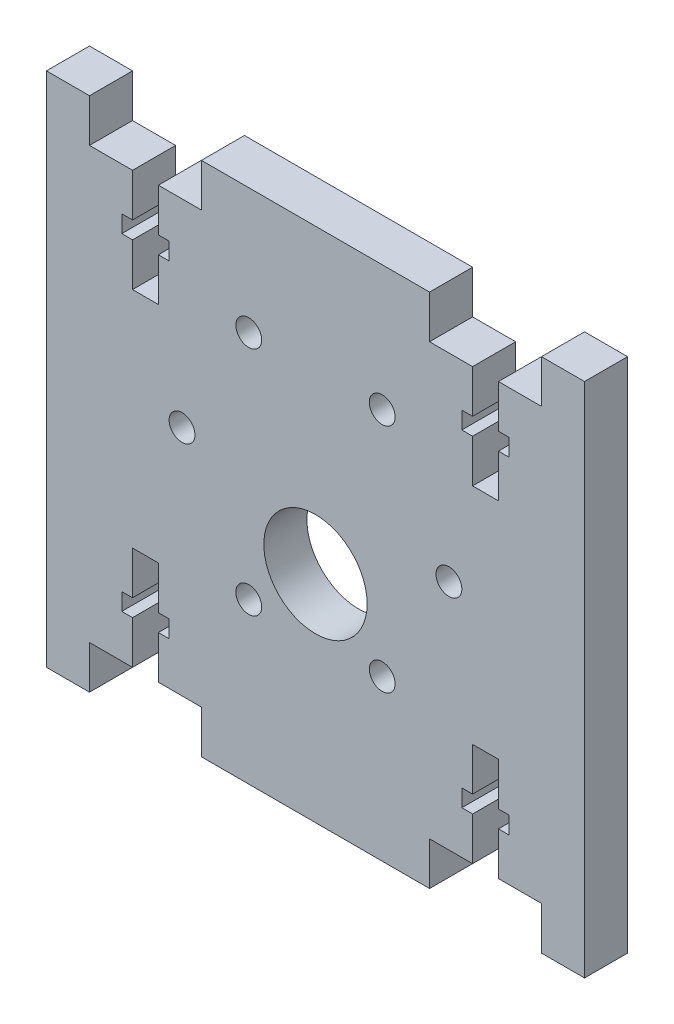
from build123d import *

# Parameters (mm, degrees)
SKETCH1_W           = 55
SKETCH1_H           = 50
SKETCH1_R           = 6
SKETCH1_R_2         = 1.5
BOSS_EXTRUDE1_DEPTH = 5
SKETCH2_W           = 5.5
SKETCH2_H           = 2
SKETCH2_W_2         = 3
SKETCH2_H_2         = 12
CUT_EXTRUDE1_DEPTH  = 5
SKETCH3_W           = 26.5
SKETCH3_H           = 5
SKETCH3_W_2         = 5
SKETCH3_H_2         = 60
BOSS_EXTRUDE2_DEPTH = 5


with BuildPart() as part:
    # Sketch1 → Boss-Extrude1 (new body)
    with BuildSketch(Plane.XY):
        with Locations((0, -2)):
            Rectangle(SKETCH1_W, SKETCH1_H)
        with Locations((0, -7)):
            Circle(SKETCH1_R, mode=Mode.SUBTRACT)
        with Locations((-15.5, 0)):
            Circle(SKETCH1_R_2, mode=Mode.SUBTRACT)
        with Locations((-7.75, 13.423393759)):
            Circle(SKETCH1_R_2, mode=Mode.SUBTRACT)
        with Locations((7.75, 13.423393759)):
            Circle(SKETCH1_R_2, mode=Mode.SUBTRACT)
        with Locations((15.5, 0)):
            Circle(SKETCH1_R_2, mode=Mode.SUBTRACT)
        with Locations((7.75, -13.423393759)):
            Circle(SKETCH1_R_2, mode=Mode.SUBTRACT)
        with Locations((-7.75, -13.423393759)):
            Circle(SKETCH1_R_2, mode=Mode.SUBTRACT)
    extrude(amount=BOSS_EXTRUDE1_DEPTH)

    # Sketch2 → Cut-Extrude1 (cut)
    with BuildSketch(Plane.XY.offset(5)):
        with Locations((-19.75, -21)):
            Rectangle(SKETCH2_W, SKETCH2_H)
        with Locations((19.75, -21)):
            Rectangle(SKETCH2_W, SKETCH2_H)
        with Locations((-19.75, -21)):
            Rectangle(SKETCH2_W_2, SKETCH2_H_2)
        with Locations((19.75, -21)):
            Rectangle(SKETCH2_W_2, SKETCH2_H_2)
        with Locations((19.75, 17)):
            Rectangle(SKETCH2_W_2, SKETCH2_H_2)
        with Locations((-19.75, 17)):
            Rectangle(SKETCH2_W_2, SKETCH2_H_2)
        with Locations((19.75, 17)):
            Rectangle(SKETCH2_W, SKETCH2_H)
        with Locations((-19.75, 17)):
            Rectangle(SKETCH2_W, SKETCH2_H)
    extrude(amount=-CUT_EXTRUDE1_DEPTH, mode=Mode.SUBTRACT)

    # Sketch3 → Boss-Extrude2 (add)
    with BuildSketch(Plane.XY.offset(5)):
        with Locations((0, -29.5)):
            Rectangle(SKETCH3_W, SKETCH3_H)
        with Locations((28.75, -2)):
            Rectangle(SKETCH3_W_2, SKETCH3_H_2)
        with Locations((-28.75, -2)):
            Rectangle(SKETCH3_W_2, SKETCH3_H_2)
        with Locations((0, 25.5)):
            Rectangle(SKETCH3_W, SKETCH3_H)
    extrude(amount=-BOSS_EXTRUDE2_DEPTH)


solid = part.part
